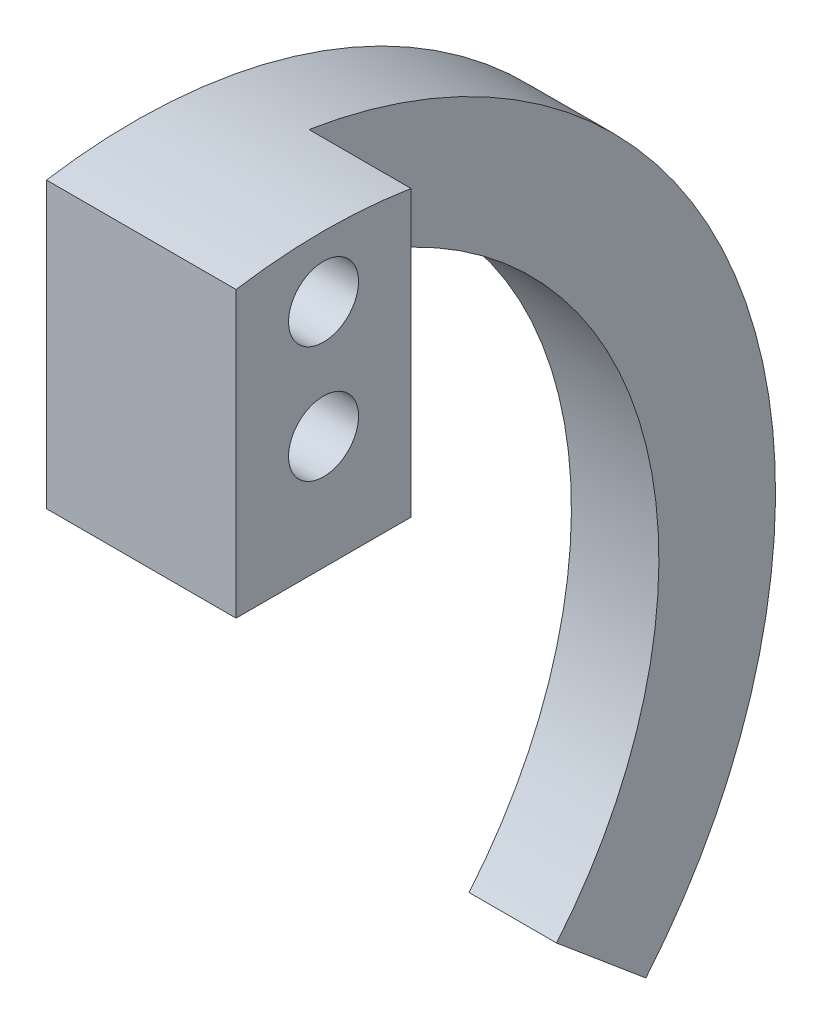
from build123d import *

# Parameters (mm, degrees)
CROQUIS1_R              = 0.6
SALIENTE_EXTRUIR1_DEPTH = 1.5
CROQUIS2_R              = 0.6
SALIENTE_EXTRUIR2_DEPTH = 1.75


with BuildPart() as part:
    # Croquis1 → Saliente-Extruir1 (new body)
    with BuildSketch(Plane(origin=(0, 0, 0), x_dir=(0, 0, -1), z_dir=(1, 0, 0))):
        with BuildLine():
            Line((-1.5, 4.5), (1.5, 4.5))
            Line((1.5, 4.5), (1.5, 7.348469228))
            ThreePointArc((1.5, 7.348469228), (7.081464794, 2.470395994), (5.745333323, -4.820907073))
            Line((5.745333323, -4.820907073), (7.27742221, -6.106482292))
            ThreePointArc((7.27742221, -6.106482292), (8.264918277, 4.684135553), (-1.5, 9.38083152))
            Line((-1.5, 9.38083152), (-1.5, 4.5))
        make_face()
        with Locations((0, 8.45)):
            Circle(CROQUIS1_R, mode=Mode.SUBTRACT)
        with Locations((0, 6.45)):
            Circle(CROQUIS1_R, mode=Mode.SUBTRACT)
    extrude(amount=SALIENTE_EXTRUIR1_DEPTH)

    # Croquis2 → Saliente-Extruir2 (add)
    with BuildSketch(Plane(origin=(1.5, 0, 0), x_dir=(0, 0, -1), z_dir=(1, 0, 0))):
        with BuildLine():
            Line((-1.5, 4.5), (1.5, 4.5))
            Line((1.5, 4.5), (1.5, 9.38083152))
            ThreePointArc((1.5, 9.38083152), (0, 9.5), (-1.5, 9.38083152))
            Line((-1.5, 9.38083152), (-1.5, 4.5))
        make_face()
        with Locations((0, 6.45)):
            Circle(CROQUIS2_R, mode=Mode.SUBTRACT)
        with Locations((0, 8.45)):
            Circle(CROQUIS2_R, mode=Mode.SUBTRACT)
    extrude(amount=SALIENTE_EXTRUIR2_DEPTH)


solid = part.part
